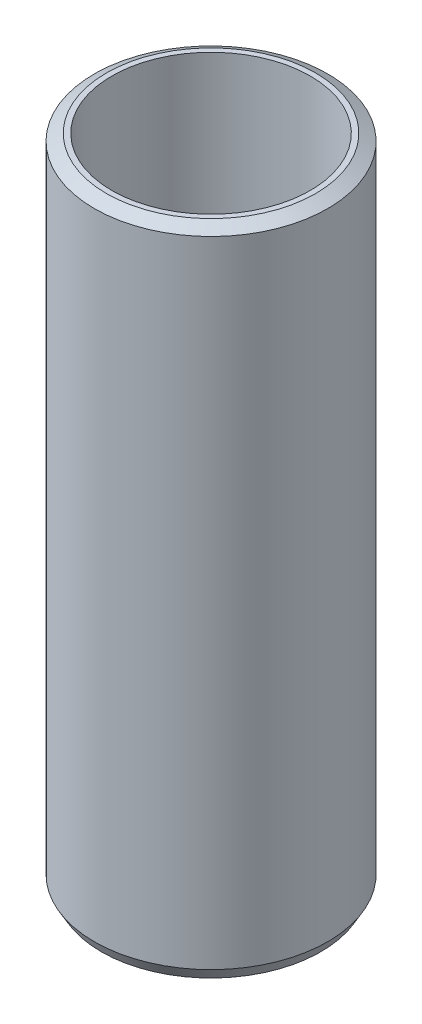
from build123d import *
from OCP.BRepFilletAPI import BRepFilletAPI_MakeChamfer

# Parameters (mm, degrees)
SKETCH1_R           = 55
BOSS_EXTRUDE1_DEPTH = 308.205742817
SKETCH2_R           = 46.758257788
CUT_EXTRUDE1_DEPTH  = 318.869123862
CHAMFER1_SIZE       = 3.25531559
CHAMFER1_SIZE2      = 5.730307067


with BuildPart() as part:
    # Sketch1 → Boss-Extrude1 (new body)
    with BuildSketch(Plane(origin=(0, 0, 0), x_dir=(1, 0, 0), z_dir=(0, 1, 0))):
        Circle(SKETCH1_R)
    extrude(amount=BOSS_EXTRUDE1_DEPTH)

    # Sketch2 → Cut-Extrude1 (cut, through all)
    with BuildSketch(Plane(origin=(0, 0, 0), x_dir=(1, 0, 0), z_dir=(0, 1, 0))):
        Circle(SKETCH2_R)
    extrude(amount=CUT_EXTRUDE1_DEPTH, mode=Mode.SUBTRACT)

    # Chamfer1: one chamfer whose edges measure the first distance from different faces: ONE call of the kernel's chamfer builder (chamfer() names one face for all edges)
    chamfer1_edges_1 = [part.edges().sort_by_distance(p)[0] for p in [
        (-55, 308.205742817, 0),
    ]]
    chamfer1_side_1 = [part.faces().sort_by_distance(p)[0] for p in [
        (-55, 154.102871408, 0),
    ]]
    chamfer1_edges_2 = [part.edges().sort_by_distance(p)[0] for p in [
        (-55, 0, 0),
    ]]
    chamfer1_side_2 = [part.faces().sort_by_distance(p)[0] for p in [
        (-53.444365081, 0, 0),
    ]]
    chamfer1 = BRepFilletAPI_MakeChamfer(part.part.solid().wrapped)
    for e in chamfer1_edges_1:
        chamfer1.Add(CHAMFER1_SIZE, CHAMFER1_SIZE2, e.wrapped, chamfer1_side_1[0].wrapped)  # the first distance lies on this face
    for e in chamfer1_edges_2:
        chamfer1.Add(CHAMFER1_SIZE, CHAMFER1_SIZE2, e.wrapped, chamfer1_side_2[0].wrapped)  # the first distance lies on this face
    add(Compound.cast(chamfer1.Shape()), mode=Mode.REPLACE)


solid = part.part
